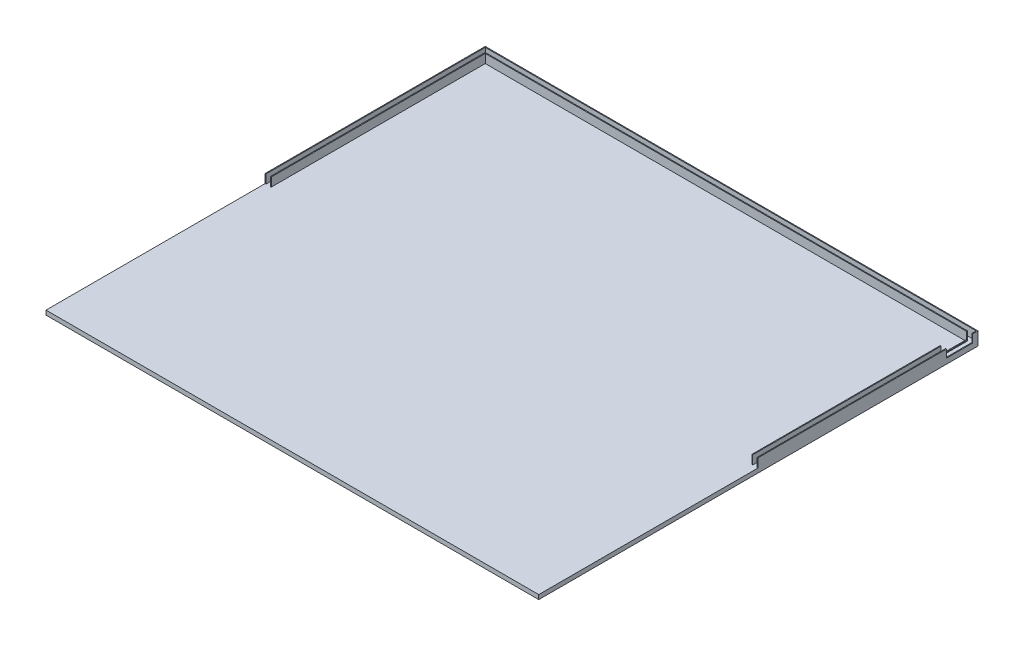
from build123d import *

# Parameters (mm, degrees)
ESBO_O1_W                = 562
ESBO_O1_H                = 501
RESSALTO_EXTRUS_O1_DEPTH = 5
ESBO_O2_W                = 7
ESBO_O2_H                = 251
RESSALTO_EXTRUS_O2_DEPTH = 10
ESBO_O6_W                = 7
ESBO_O6_H                = 251
RESSALTO_EXTRUS_O3_DEPTH = 10
ESBO_O7_W                = 5
ESBO_O7_H                = 251
CORTE_EXTRUS_O1_DEPTH    = 10
ESBO_O9_W                = 5
ESBO_O9_H                = 251
CORTE_EXTRUS_O3_DEPTH    = 10
ESBO_O10_W               = 562
ESBO_O10_H               = 7
RESSALTO_EXTRUS_O4_DEPTH = 10
ESBO_O15_W               = 560
ESBO_O15_H               = 5
CORTE_EXTRUS_O11_DEPTH   = 10
ESBO_O16_W               = 5
ESBO_O16_H               = 1
CORTE_EXTRUS_O12_DEPTH   = 10
ESBO_O20_R               = 15
RESSALTO_EXTRUS_O5_DEPTH = 10
ESBO_O21_W               = 1
ESBO_O21_H               = 29
ESBO_O21_H_2             = 30
CORTE_EXTRUS_O13_DEPTH   = 9


with BuildPart() as part:
    # Esboço1 → Ressalto-extrusão1 (new body)
    with BuildSketch(Plane(origin=(0, 0, 0), x_dir=(1, 0, 0), z_dir=(0, 1, 0))):
        with Locations((183.395426849, -179.414405214)):
            Rectangle(ESBO_O1_W, ESBO_O1_H)
    extrude(amount=RESSALTO_EXTRUS_O1_DEPTH)

    # Esboço2 → Ressalto-extrusão2 (add)
    with BuildSketch(Plane(origin=(0, 5, 0), x_dir=(1, 0, 0), z_dir=(0, 1, 0))):
        with Locations((-94.104573151, -54.414405214)):
            Rectangle(ESBO_O2_W, ESBO_O2_H)
    extrude(amount=RESSALTO_EXTRUS_O2_DEPTH)

    # Esboço6 → Ressalto-extrusão3 (add)
    with BuildSketch(Plane(origin=(0, 5, 0), x_dir=(1, 0, 0), z_dir=(0, 1, 0))):
        with Locations((460.895426849, -54.414405214)):
            Rectangle(ESBO_O6_W, ESBO_O6_H)
    extrude(amount=RESSALTO_EXTRUS_O3_DEPTH)

    # Esboço7 → Corte-extrusão1 (cut)
    with BuildSketch(Plane(origin=(0, 15, 0), x_dir=(1, 0, 0), z_dir=(0, 1, 0))):
        with Locations((-94.104573151, -54.414405214)):
            Rectangle(ESBO_O7_W, ESBO_O7_H)
    extrude(amount=-CORTE_EXTRUS_O1_DEPTH, mode=Mode.SUBTRACT)

    # Esboço9 → Corte-extrusão3 (cut)
    with BuildSketch(Plane(origin=(0, 15, 0), x_dir=(1, 0, 0), z_dir=(0, 1, 0))):
        with Locations((460.895426849, -54.414405214)):
            Rectangle(ESBO_O9_W, ESBO_O9_H)
    extrude(amount=-CORTE_EXTRUS_O3_DEPTH, mode=Mode.SUBTRACT)

    # Esboço10 → Ressalto-extrusão4 (add)
    with BuildSketch(Plane(origin=(0, 5, 0), x_dir=(1, 0, 0), z_dir=(0, 1, 0))):
        with Locations((183.395426849, 67.585594786)):
            Rectangle(ESBO_O10_W, ESBO_O10_H)
    extrude(amount=RESSALTO_EXTRUS_O4_DEPTH)

    # Esboço15 → Corte-extrusão11 (cut)
    with BuildSketch(Plane(origin=(0, 15, 0), x_dir=(1, 0, 0), z_dir=(0, 1, 0))):
        with Locations((183.395426849, 67.585594786)):
            Rectangle(ESBO_O15_W, ESBO_O15_H)
    extrude(amount=-CORTE_EXTRUS_O11_DEPTH, mode=Mode.SUBTRACT)

    # Esboço16 → Corte-extrusão12 (cut)
    with BuildSketch(Plane(origin=(0, 15, 0), x_dir=(1, 0, 0), z_dir=(0, 1, 0))):
        with Locations((460.895426849, 64.585594786)):
            Rectangle(ESBO_O16_W, ESBO_O16_H)
        with Locations((-94.104573151, 64.585594786)):
            Rectangle(ESBO_O16_W, ESBO_O16_H)
    extrude(amount=-CORTE_EXTRUS_O12_DEPTH, mode=Mode.SUBTRACT)

    # Esboço20 → Ressalto-extrusão5 (add)
    with BuildSketch(Plane.XZ):
        with Locations((-47.604573151, 379.914405214)):
            Circle(ESBO_O20_R)
        with Locations((414.395426849, 379.914405214)):
            Circle(ESBO_O20_R)
        with Locations((414.395426849, -21.085594786)):
            Circle(ESBO_O20_R)
        with Locations((-47.604573151, -21.085594786)):
            Circle(ESBO_O20_R)
    extrude(amount=RESSALTO_EXTRUS_O5_DEPTH)

    # Esboço21 → Corte-extrusão13 (cut)
    with BuildSketch(Plane(origin=(0, 15, 0), x_dir=(1, 0, 0), z_dir=(0, 1, 0))):
        with Locations((457.895426849, 49.585594786)):
            Rectangle(ESBO_O21_W, ESBO_O21_H)
        with Locations((463.895426849, 50.085594786)):
            Rectangle(ESBO_O21_W, ESBO_O21_H_2)
    extrude(amount=-CORTE_EXTRUS_O13_DEPTH, mode=Mode.SUBTRACT)


solid = part.part
